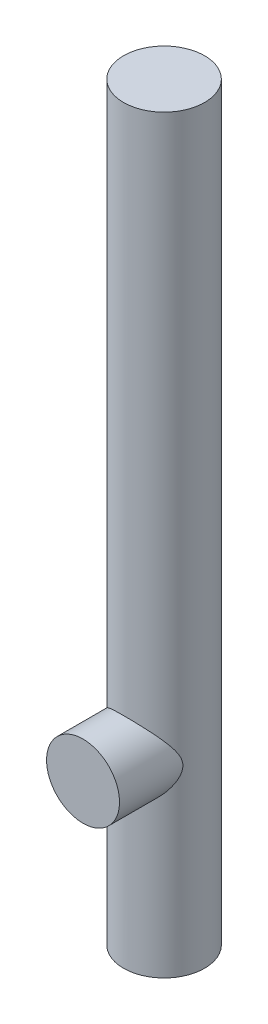
from build123d import *

# Parameters (mm, degrees)
SZKIC1_R                        = 10
DODANIE_WYCI_GNI_CIE1_DEPTH     = 185
DODANIE_WYCI_GNI_CIE2_START     = 4.358898842
DODANIE_WYCI_GNI_CIE2_OUTLINE_R = 9
DODANIE_WYCI_GNI_CIE2_DEPTH     = 15.641101158


# Read off the part's stored shape, not the designer's step: Dodanie-wyciągnięcie2
with BuildPart() as part:
    # Szkic1 → Dodanie-wyciągnięcie1 (new body)
    with BuildSketch(Plane(origin=(0, 0, 0), x_dir=(1, 0, 0), z_dir=(0, 1, 0))):
        with Locations(Location((0, 0, 0), (0, 0, 270))):
            Circle(SZKIC1_R)
    extrude(amount=DODANIE_WYCI_GNI_CIE1_DEPTH)

    # Dodanie-wyciągnięcie2 outline → Dodanie-wyciągnięcie2 (add)
    with BuildSketch(Plane.XY.offset(DODANIE_WYCI_GNI_CIE2_START)):
        with Locations((0, 45)):
            Circle(DODANIE_WYCI_GNI_CIE2_OUTLINE_R)
    extrude(amount=DODANIE_WYCI_GNI_CIE2_DEPTH)


solid = part.part
